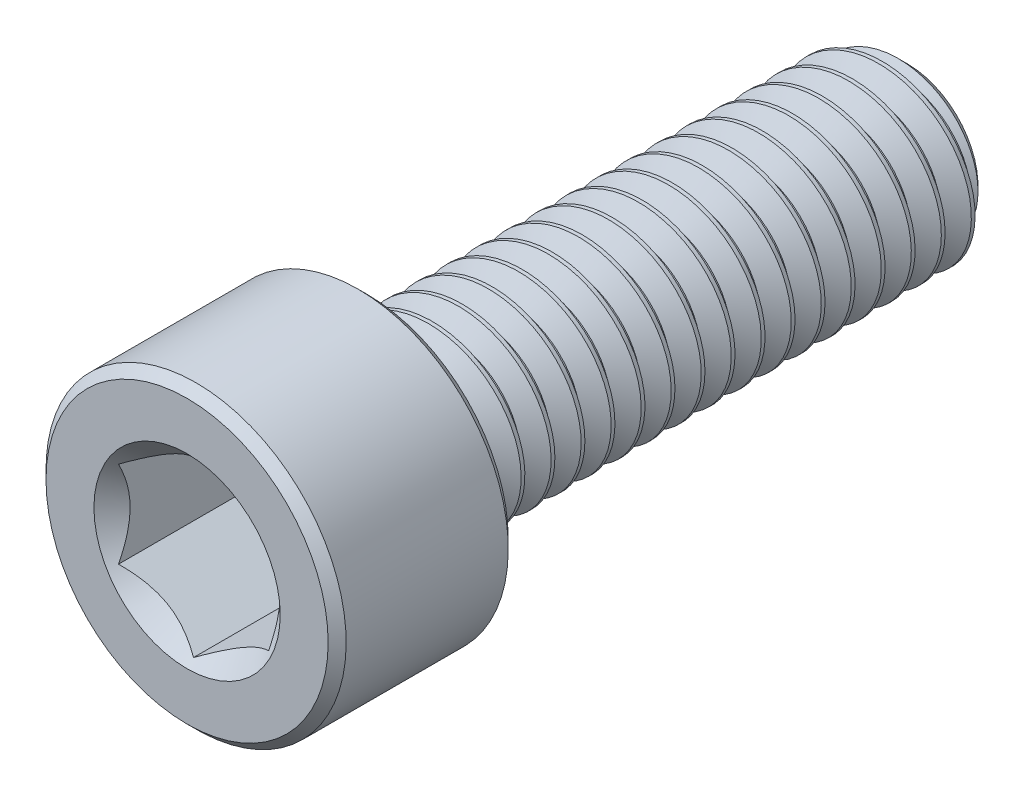
from build123d import *

# Parameters (mm, degrees)
CUT_EXTRUDE1_DEPTH     = 5
SKETCH4_R              = 3.103257697
CUT_EXTRUDE2_DEPTH     = 3
CUT_EXTRUDE2_DRAFT     = -45
SPLIT1_SURFACE_1_BACK  = 28.857
SPLIT1_SURFACE_1_DEPTH = 57.714
SPLIT1_SURFACE_2_BACK  = 28.857
SPLIT1_SURFACE_2_DEPTH = 57.714
CUT_SWEEP1_PITCH       = 1


with BuildPart() as part:
    # Sketch2 → Revolve1 (revolve)
    with BuildSketch(Plane(origin=(0, 0, 0), x_dir=(0, 0, -1), z_dir=(1, 0, 0))):
        with BuildLine():
            Line((-12, 0), (-12, 4.7))
            Line((-12, 4.7), (-11.7, 5))
            Line((-11.7, 5), (-6.3, 5))
            Line((-6.3, 5), (-6, 4.7))
            Line((-6, 4.7), (-6, 3.3))
            ThreePointArc((-6, 3.3), (-5.912132034, 3.087867966), (-5.7, 3))
            Line((-5.7, 3), (11.350480947, 3))
            Line((11.350480947, 3), (12, 2.350480947))
            Line((12, 2.350480947), (12, 0))
            Line((12, 0), (-12, 0))
        make_face()
    revolve(axis=Axis((0, 0, -12), (0, 0, 1)))

    # Sketch3 → Cut-Extrude1 (cut)
    with BuildSketch(Plane.XY.offset(12)):
        Polygon((2.5, -1.443375673), (2.5, 1.443375673), (0, 2.886751346), (-2.5, 1.443375673), (-2.5, -1.443375673), (0, -2.886751346), align=None)
    extrude(amount=-CUT_EXTRUDE1_DEPTH, mode=Mode.SUBTRACT)


with BuildPart() as cut_extrude2_tool:
    # Sketch4 → Cut-Extrude2 (with draft: the straight prism first)
    with BuildSketch(Plane.XY.offset(12)):
        Circle(SKETCH4_R)
    extrude(amount=-CUT_EXTRUDE2_DEPTH)
    # Cut-Extrude2: the draft: its side faces are tilted about the plane it starts from
    cut_extrude2_sides = [cut_extrude2_tool.faces().sort_by_distance(p)[0] for p in [
        (-3.103257697, 0, 10.5),
    ]]
    draft(cut_extrude2_sides, Plane.XY.offset(12), CUT_EXTRUDE2_DRAFT)


with BuildPart() as part_1:
    add(part.part)

    # Cut-Extrude2: cut by cut_extrude2_tool
    add(cut_extrude2_tool.part, mode=Mode.SUBTRACT)


with BuildPart() as body_2:
    # Split1: the piece behind the surface
    add(part_1.part)
    # Split1 surface: a surface, the sketch's curves swept straight by 57.714 mm
    with BuildLine(Plane(origin=(0, 0, 0), x_dir=(0, 0, -1), z_dir=(1, 0, 0)).offset(-SPLIT1_SURFACE_1_BACK), mode=Mode.PRIVATE) as split1_surface_1_path:
        Line((-5.7, -5), (-5.7, 5))
    split1_surface_1 = Shell.extrude(split1_surface_1_path.wire(), (1 * SPLIT1_SURFACE_1_DEPTH, 0 * SPLIT1_SURFACE_1_DEPTH, 0 * SPLIT1_SURFACE_1_DEPTH))
    split(bisect_by=split1_surface_1, keep=Keep.BOTTOM)

    # Cut-Sweep1: the profile of Sketch7 screwed along a right-hand helix of 19 turns, 8 arcs to a turn; built about Z, then put on its axis
    cut_sweep1_z = Axis((0, 0, 0), (0, 0, 1))
    cut_sweep1_corners = [(3.054126588, 0, 0.03125), (3.054126588, 0, -0.90625), (2.350480947, 0, -0.5), (2.350480947, 0, -0.375)]
    with BuildLine(mode=Mode.PRIVATE) as cut_sweep1_profile:
        Line(cut_sweep1_corners[0], cut_sweep1_corners[1])
        Line(cut_sweep1_corners[1], cut_sweep1_corners[2])
        Line(cut_sweep1_corners[2], cut_sweep1_corners[3])
        Line(cut_sweep1_corners[3], cut_sweep1_corners[0])
    cut_sweep1_cap = Face(cut_sweep1_profile.wire())
    cut_sweep1_turn_angles = [0, 22.5, 45, 67.5, 90, 112.5, 135, 157.5, 180, 202.5, 225, 247.5, 270, 292.5, 315, 337.5, 360]
    cut_sweep1_turn_weights = [1, 0.9238795325112867, 1, 0.9238795325112867, 1, 0.9238795325112867, 1, 0.9238795325112867, 1, 0.9238795325112867, 1, 0.9238795325112867, 1, 0.9238795325112867, 1, 0.9238795325112867, 1]
    cut_sweep1_turn_rails = [Edge.make_bspline([Vector(p[0], p[1], 0).rotate(cut_sweep1_z, cut_sweep1_turn_angles[k]) / cut_sweep1_turn_weights[k] + Vector(0, 0, p[2] + CUT_SWEEP1_PITCH * cut_sweep1_turn_angles[k] / 360) for k in range(17)], [0, 0, 0, 1, 1, 2, 2, 3, 3, 4, 4, 5, 5, 6, 6, 7, 7, 8, 8, 8], 2, cut_sweep1_turn_weights) for p in cut_sweep1_corners]
    cut_sweep1_turn_sides = [Face.make_surface_from_curves(cut_sweep1_turn_rails[p[0]], cut_sweep1_turn_rails[p[1]]) for p in [(0, 1), (1, 2), (2, 3), (3, 0)]]
    cut_sweep1 = Plane(origin=(0, 0, -12), x_dir=(0, 1, 0), z_dir=(0, 0, 1)) * Solid(Shell([*[p.moved(Location((0, 0, CUT_SWEEP1_PITCH * i))) for i in range(19) for p in cut_sweep1_turn_sides], cut_sweep1_cap, cut_sweep1_cap.rotate(cut_sweep1_z, 6840).moved(Location((0, 0, CUT_SWEEP1_PITCH * 6840 / 360)))]))
    add(cut_sweep1, mode=Mode.SUBTRACT)


with BuildPart() as part_2:
    add(part_1.part)

    # Split1: split by a surface, the side it looks to stays
    # Split1 surface: a surface, the sketch's curves swept straight by 57.714 mm
    with BuildLine(Plane(origin=(0, 0, 0), x_dir=(0, 0, -1), z_dir=(1, 0, 0)).offset(-SPLIT1_SURFACE_2_BACK), mode=Mode.PRIVATE) as split1_surface_2_path:
        Line((-5.7, -5), (-5.7, 5))
    split1_surface_2 = Shell.extrude(split1_surface_2_path.wire(), (1 * SPLIT1_SURFACE_2_DEPTH, 0 * SPLIT1_SURFACE_2_DEPTH, 0 * SPLIT1_SURFACE_2_DEPTH))
    split(bisect_by=split1_surface_2, keep=Keep.TOP)

    add(body_2.part)  # Revolve2 merges body 2
    # Sketch8 → Revolve2 (revolve)
    with BuildSketch(Plane(origin=(0, 0, 0), x_dir=(0, 0, -1), z_dir=(1, 0, 0))):
        Polygon((-6, 0), (-6, 3), (-5.7, 3), (-3.967949192, 0), align=None)
    revolve(axis=Axis((0, 0, 3.967949192), (0, 0, 1)))


solid = part_2.part
